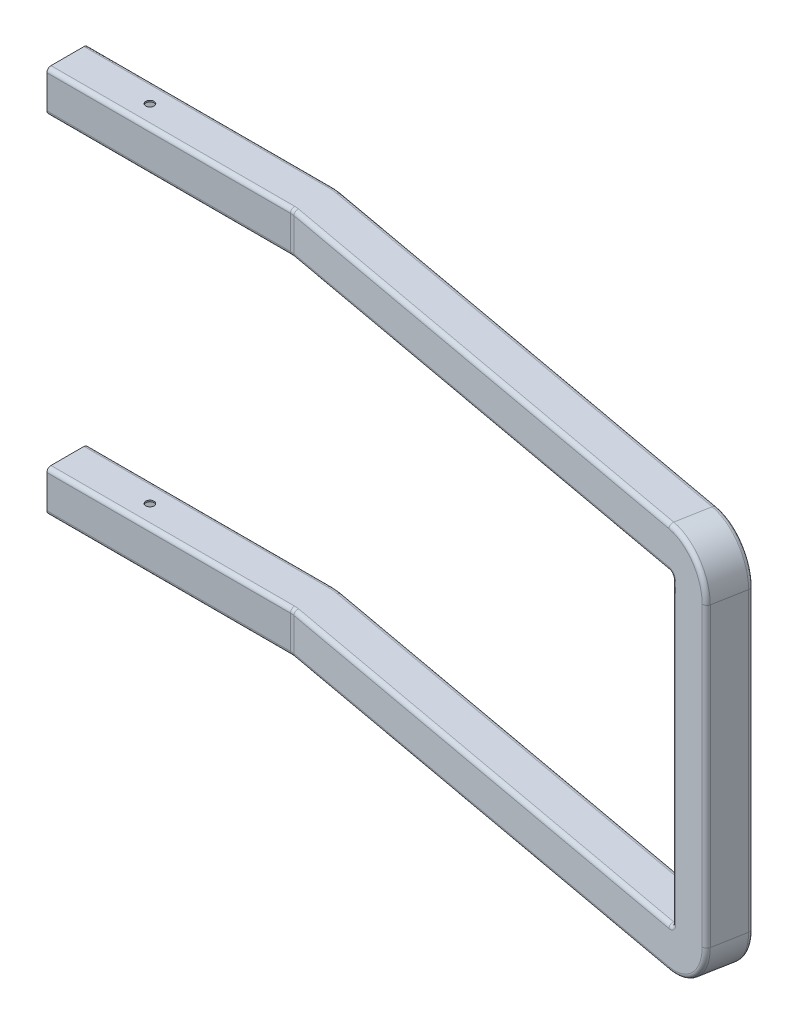
from build123d import *

# Parameters (mm, degrees)
SKETCH21_R         = 5
CUT_EXTRUDE3_DEPTH = 904.831538957


with BuildPart() as part:
    # Sweep-Thin3: sweep along a curve in space
    with BuildLine() as sweep_thin3_path:
        Line((0, 0, 0), (-50, 0, 0))
        Line((0, 0, 0), (245.484298454, 0, 0))
        ThreePointArc((254.442631788, 0, 0.809063194), (249.981695461, 0, 0.202676576), (245.484298454, 0, 0))
        Line((254.442631788, 0, 0.809063194), (810.776679593, 0, 102.125))
        ThreePointArc((840.291241677, -30, 107.5), (831.646626586, -8.786796564, 105.925698949), (810.776679593, 0, 102.125))
        Line((840.291241677, -30, 107.5), (840.291241677, -210, 107.5))
    # Sketch2 → Sweep-Thin3 (sweep)
    with BuildSketch(Plane(origin=(0, 0, 0), x_dir=(0, 0, -1), z_dir=(1, 0, 0))):
        with BuildLine():
            Line((20, 25), (-20, 25))
            ThreePointArc((-20, 25), (-23.535533906, 23.535533906), (-25, 20))
            Line((-25, 20), (-25, -20))
            ThreePointArc((-25, -20), (-23.535533906, -23.535533906), (-20, -25))
            Line((-20, -25), (20, -25))
            ThreePointArc((20, -25), (23.535533906, -23.535533906), (25, -20))
            Line((25, -20), (25, 20))
            ThreePointArc((25, 20), (23.535533906, 23.535533906), (20, 25))
        make_face()
        with BuildLine():
            Line((20, 23.35), (-20, 23.35))
            ThreePointArc((-20, 23.35), (-22.368807717, 22.368807717), (-23.35, 20))
            Line((-23.35, 20), (-23.35, -20))
            ThreePointArc((-23.35, -20), (-22.368807717, -22.368807717), (-20, -23.35))
            Line((-20, -23.35), (20, -23.35))
            ThreePointArc((20, -23.35), (22.368807717, -22.368807717), (23.35, -20))
            Line((23.35, -20), (23.35, 20))
            ThreePointArc((23.35, 20), (22.368807717, 22.368807717), (20, 23.35))
        make_face(mode=Mode.SUBTRACT)
    sweep_thin3 = sweep(path=sweep_thin3_path.line)

    # Sketch21 → Cut-Extrude3 (cut, symmetric)
    with BuildSketch(Plane(origin=(0, 0, 0), x_dir=(1, 0, 0), z_dir=(0, 1, 0))):
        with Locations((50, 0)):
            Circle(SKETCH21_R)
    cut_extrude3 = extrude(amount=CUT_EXTRUDE3_DEPTH, both=True, mode=Mode.SUBTRACT)

    # Mirror1: Sweep-Thin3, Cut-Extrude3 across plane
    add(sweep_thin3.mirror(Plane(origin=(0, -210, 0), x_dir=(0, 0, 1), z_dir=(0, -1, 0))))
    add(cut_extrude3.mirror(Plane(origin=(0, -210, 0), x_dir=(0, 0, 1), z_dir=(0, -1, 0))), mode=Mode.SUBTRACT)


solid = part.part
